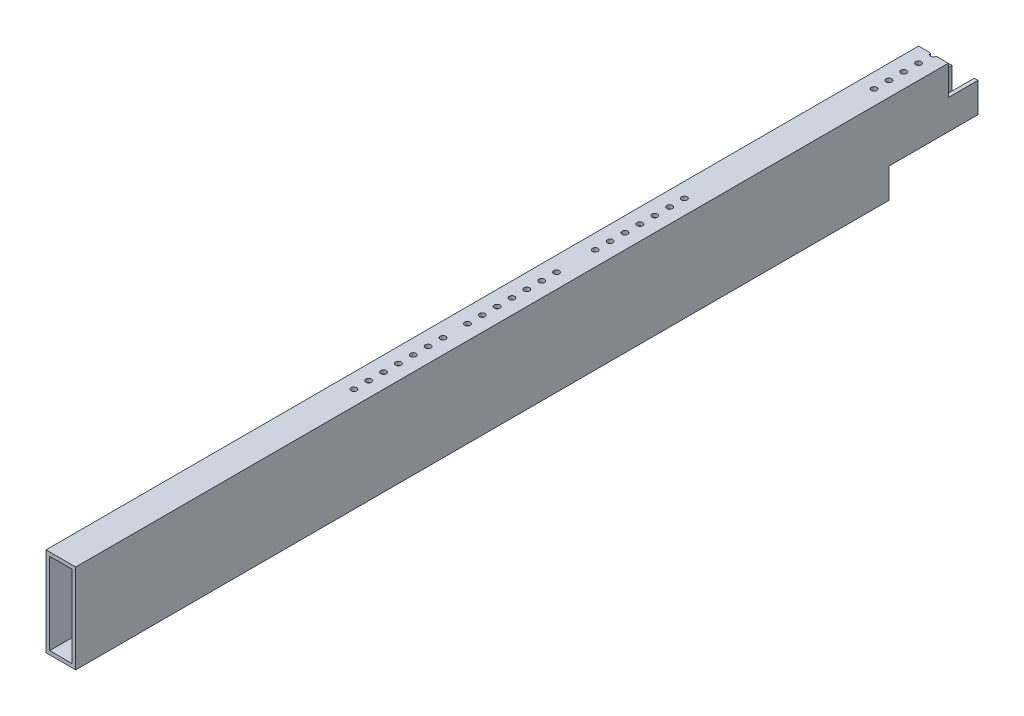
from build123d import *

# Parameters (mm, degrees)
SKETCH1_W           = 25.4
SKETCH1_H           = 76.2
BOSS_EXTRUDE1_DEPTH = 385.699
SHELL1_T            = -3.175
SKETCH2_W           = 76.2
SKETCH2_H           = 25.4
CUT_EXTRUDE1_DEPTH  = 389.407632007
SKETCH3_W           = 25.4
SKETCH3_H           = 25.4
CUT_EXTRUDE2_DEPTH  = 389.407632007
CUT_EXTRUDE3_REACH  = 395.359
SKETCH4_R           = 2.38125
CUT_EXTRUDE4_REACH  = 395.359
SKETCH5_R           = 2.38125


with BuildPart() as part:
    # Sketch1 → Boss-Extrude1 (new, symmetric)
    with BuildSketch(Plane.XY):
        Rectangle(SKETCH1_W, SKETCH1_H)
    extrude(amount=BOSS_EXTRUDE1_DEPTH, both=True)

    # Shell1
    shell1_openings = [part.faces().sort_by_distance(p)[0] for p in [
        (0, 0, -385.699),
        (0, 0, 385.699),
    ]]
    offset(amount=SHELL1_T, openings=shell1_openings, kind=Kind.INTERSECTION)

    # Sketch2 → Cut-Extrude1 (cut, through all)
    with BuildSketch(Plane(origin=(12.7, 0, 0), x_dir=(0, 0, -1), z_dir=(1, 0, 0))):
        with Locations((347.599, -25.4)):
            Rectangle(SKETCH2_W, SKETCH2_H)
    extrude(amount=-CUT_EXTRUDE1_DEPTH, mode=Mode.SUBTRACT)

    # Sketch3 → Cut-Extrude2 (cut, through all)
    with BuildSketch(Plane(origin=(12.7, 0, 0), x_dir=(0, 0, -1), z_dir=(1, 0, 0))):
        with Locations((372.999, 25.4)):
            Rectangle(SKETCH3_W, SKETCH3_H)
    extrude(amount=-CUT_EXTRUDE2_DEPTH, mode=Mode.SUBTRACT)

    # Sketch4 → Cut-Extrude3 (cut, up to next)
    with BuildSketch(Plane(origin=(0, 38.1, 0), x_dir=(1, 0, 0), z_dir=(0, 1, 0)), mode=Mode.PRIVATE) as cut_extrude3_sk1:
        with Locations((0, 147.394483214)):
            Circle(SKETCH4_R)
    cut_extrude3_tool1 = extrude(cut_extrude3_sk1.sketch, amount=-CUT_EXTRUDE3_REACH, mode=Mode.PRIVATE) & part.part
    # Sketch4 → Cut-Extrude3 (cut, up to next)
    with BuildSketch(Plane(origin=(0, 38.1, 0), x_dir=(1, 0, 0), z_dir=(0, 1, 0)), mode=Mode.PRIVATE) as cut_extrude3_sk2:
        with Locations((0, 134.694483214)):
            Circle(SKETCH4_R)
    cut_extrude3_tool2 = extrude(cut_extrude3_sk2.sketch, amount=-CUT_EXTRUDE3_REACH, mode=Mode.PRIVATE) & part.part
    # Sketch4 → Cut-Extrude3 (cut, up to next)
    with BuildSketch(Plane(origin=(0, 38.1, 0), x_dir=(1, 0, 0), z_dir=(0, 1, 0)), mode=Mode.PRIVATE) as cut_extrude3_sk3:
        with Locations((0, 121.994483214)):
            Circle(SKETCH4_R)
    cut_extrude3_tool3 = extrude(cut_extrude3_sk3.sketch, amount=-CUT_EXTRUDE3_REACH, mode=Mode.PRIVATE) & part.part
    # Sketch4 → Cut-Extrude3 (cut, up to next)
    with BuildSketch(Plane(origin=(0, 38.1, 0), x_dir=(1, 0, 0), z_dir=(0, 1, 0)), mode=Mode.PRIVATE) as cut_extrude3_sk4:
        with Locations((0, 109.294483214)):
            Circle(SKETCH4_R)
    cut_extrude3_tool4 = extrude(cut_extrude3_sk4.sketch, amount=-CUT_EXTRUDE3_REACH, mode=Mode.PRIVATE) & part.part
    # Sketch4 → Cut-Extrude3 (cut, up to next)
    with BuildSketch(Plane(origin=(0, 38.1, 0), x_dir=(1, 0, 0), z_dir=(0, 1, 0)), mode=Mode.PRIVATE) as cut_extrude3_sk5:
        with Locations((0, 96.594483214)):
            Circle(SKETCH4_R)
    cut_extrude3_tool5 = extrude(cut_extrude3_sk5.sketch, amount=-CUT_EXTRUDE3_REACH, mode=Mode.PRIVATE) & part.part
    # Sketch4 → Cut-Extrude3 (cut, up to next)
    with BuildSketch(Plane(origin=(0, 38.1, 0), x_dir=(1, 0, 0), z_dir=(0, 1, 0)), mode=Mode.PRIVATE) as cut_extrude3_sk6:
        with Locations((0, 83.894483214)):
            Circle(SKETCH4_R)
    cut_extrude3_tool6 = extrude(cut_extrude3_sk6.sketch, amount=-CUT_EXTRUDE3_REACH, mode=Mode.PRIVATE) & part.part
    # Sketch4 → Cut-Extrude3 (cut, up to next)
    with BuildSketch(Plane(origin=(0, 38.1, 0), x_dir=(1, 0, 0), z_dir=(0, 1, 0)), mode=Mode.PRIVATE) as cut_extrude3_sk7:
        with Locations((0, 71.194483214)):
            Circle(SKETCH4_R)
    cut_extrude3_tool7 = extrude(cut_extrude3_sk7.sketch, amount=-CUT_EXTRUDE3_REACH, mode=Mode.PRIVATE) & part.part
    # Sketch4 → Cut-Extrude3 (cut, up to next)
    with BuildSketch(Plane(origin=(0, 38.1, 0), x_dir=(1, 0, 0), z_dir=(0, 1, 0)), mode=Mode.PRIVATE) as cut_extrude3_sk8:
        with Locations((0, 38.09873)):
            Circle(SKETCH4_R)
    cut_extrude3_tool8 = extrude(cut_extrude3_sk8.sketch, amount=-CUT_EXTRUDE3_REACH, mode=Mode.PRIVATE) & part.part
    # Sketch4 → Cut-Extrude3 (cut, up to next)
    with BuildSketch(Plane(origin=(0, 38.1, 0), x_dir=(1, 0, 0), z_dir=(0, 1, 0)), mode=Mode.PRIVATE) as cut_extrude3_sk9:
        with Locations((0, 25.39873)):
            Circle(SKETCH4_R)
    cut_extrude3_tool9 = extrude(cut_extrude3_sk9.sketch, amount=-CUT_EXTRUDE3_REACH, mode=Mode.PRIVATE) & part.part
    # Sketch4 → Cut-Extrude3 (cut, up to next)
    with BuildSketch(Plane(origin=(0, 38.1, 0), x_dir=(1, 0, 0), z_dir=(0, 1, 0)), mode=Mode.PRIVATE) as cut_extrude3_sk10:
        with Locations((0, 12.69873)):
            Circle(SKETCH4_R)
    cut_extrude3_tool10 = extrude(cut_extrude3_sk10.sketch, amount=-CUT_EXTRUDE3_REACH, mode=Mode.PRIVATE) & part.part
    # Sketch4 → Cut-Extrude3 (cut, up to next)
    with BuildSketch(Plane(origin=(0, 38.1, 0), x_dir=(1, 0, 0), z_dir=(0, 1, 0)), mode=Mode.PRIVATE) as cut_extrude3_sk11:
        with Locations((0, -0.00127)):
            Circle(SKETCH4_R)
    cut_extrude3_tool11 = extrude(cut_extrude3_sk11.sketch, amount=-CUT_EXTRUDE3_REACH, mode=Mode.PRIVATE) & part.part
    # Sketch4 → Cut-Extrude3 (cut, up to next)
    with BuildSketch(Plane(origin=(0, 38.1, 0), x_dir=(1, 0, 0), z_dir=(0, 1, 0)), mode=Mode.PRIVATE) as cut_extrude3_sk12:
        with Locations((0, -12.70127)):
            Circle(SKETCH4_R)
    cut_extrude3_tool12 = extrude(cut_extrude3_sk12.sketch, amount=-CUT_EXTRUDE3_REACH, mode=Mode.PRIVATE) & part.part
    # Sketch4 → Cut-Extrude3 (cut, up to next)
    with BuildSketch(Plane(origin=(0, 38.1, 0), x_dir=(1, 0, 0), z_dir=(0, 1, 0)), mode=Mode.PRIVATE) as cut_extrude3_sk13:
        with Locations((0, -25.40127)):
            Circle(SKETCH4_R)
    cut_extrude3_tool13 = extrude(cut_extrude3_sk13.sketch, amount=-CUT_EXTRUDE3_REACH, mode=Mode.PRIVATE) & part.part
    # Sketch4 → Cut-Extrude3 (cut, up to next)
    with BuildSketch(Plane(origin=(0, 38.1, 0), x_dir=(1, 0, 0), z_dir=(0, 1, 0)), mode=Mode.PRIVATE) as cut_extrude3_sk14:
        with Locations((0, -38.10127)):
            Circle(SKETCH4_R)
    cut_extrude3_tool14 = extrude(cut_extrude3_sk14.sketch, amount=-CUT_EXTRUDE3_REACH, mode=Mode.PRIVATE) & part.part
    # Sketch4 → Cut-Extrude3 (cut, up to next)
    with BuildSketch(Plane(origin=(0, 38.1, 0), x_dir=(1, 0, 0), z_dir=(0, 1, 0)), mode=Mode.PRIVATE) as cut_extrude3_sk15:
        with Locations((0, -58.99324371)):
            Circle(SKETCH4_R)
    cut_extrude3_tool15 = extrude(cut_extrude3_sk15.sketch, amount=-CUT_EXTRUDE3_REACH, mode=Mode.PRIVATE) & part.part
    # Sketch4 → Cut-Extrude3 (cut, up to next)
    with BuildSketch(Plane(origin=(0, 38.1, 0), x_dir=(1, 0, 0), z_dir=(0, 1, 0)), mode=Mode.PRIVATE) as cut_extrude3_sk16:
        with Locations((0, -71.69324371)):
            Circle(SKETCH4_R)
    cut_extrude3_tool16 = extrude(cut_extrude3_sk16.sketch, amount=-CUT_EXTRUDE3_REACH, mode=Mode.PRIVATE) & part.part
    # Sketch4 → Cut-Extrude3 (cut, up to next)
    with BuildSketch(Plane(origin=(0, 38.1, 0), x_dir=(1, 0, 0), z_dir=(0, 1, 0)), mode=Mode.PRIVATE) as cut_extrude3_sk17:
        with Locations((0, -84.39324371)):
            Circle(SKETCH4_R)
    cut_extrude3_tool17 = extrude(cut_extrude3_sk17.sketch, amount=-CUT_EXTRUDE3_REACH, mode=Mode.PRIVATE) & part.part
    # Sketch4 → Cut-Extrude3 (cut, up to next)
    with BuildSketch(Plane(origin=(0, 38.1, 0), x_dir=(1, 0, 0), z_dir=(0, 1, 0)), mode=Mode.PRIVATE) as cut_extrude3_sk18:
        with Locations((0, -97.09324371)):
            Circle(SKETCH4_R)
    cut_extrude3_tool18 = extrude(cut_extrude3_sk18.sketch, amount=-CUT_EXTRUDE3_REACH, mode=Mode.PRIVATE) & part.part
    # Sketch4 → Cut-Extrude3 (cut, up to next)
    with BuildSketch(Plane(origin=(0, 38.1, 0), x_dir=(1, 0, 0), z_dir=(0, 1, 0)), mode=Mode.PRIVATE) as cut_extrude3_sk19:
        with Locations((0, -109.79324371)):
            Circle(SKETCH4_R)
    cut_extrude3_tool19 = extrude(cut_extrude3_sk19.sketch, amount=-CUT_EXTRUDE3_REACH, mode=Mode.PRIVATE) & part.part
    # Sketch4 → Cut-Extrude3 (cut, up to next)
    with BuildSketch(Plane(origin=(0, 38.1, 0), x_dir=(1, 0, 0), z_dir=(0, 1, 0)), mode=Mode.PRIVATE) as cut_extrude3_sk20:
        with Locations((0, -122.49324371)):
            Circle(SKETCH4_R)
    cut_extrude3_tool20 = extrude(cut_extrude3_sk20.sketch, amount=-CUT_EXTRUDE3_REACH, mode=Mode.PRIVATE) & part.part
    # Sketch4 → Cut-Extrude3 (cut, up to next)
    with BuildSketch(Plane(origin=(0, 38.1, 0), x_dir=(1, 0, 0), z_dir=(0, 1, 0)), mode=Mode.PRIVATE) as cut_extrude3_sk21:
        with Locations((0, -135.19324371)):
            Circle(SKETCH4_R)
    cut_extrude3_tool21 = extrude(cut_extrude3_sk21.sketch, amount=-CUT_EXTRUDE3_REACH, mode=Mode.PRIVATE) & part.part
    add(cut_extrude3_tool1.solids().sort_by_distance((0, 38.1, -147.394483))[0], mode=Mode.SUBTRACT)
    add(cut_extrude3_tool2.solids().sort_by_distance((0, 38.1, -134.694483))[0], mode=Mode.SUBTRACT)
    add(cut_extrude3_tool3.solids().sort_by_distance((0, 38.1, -121.994483))[0], mode=Mode.SUBTRACT)
    add(cut_extrude3_tool4.solids().sort_by_distance((0, 38.1, -109.294483))[0], mode=Mode.SUBTRACT)
    add(cut_extrude3_tool5.solids().sort_by_distance((0, 38.1, -96.594483))[0], mode=Mode.SUBTRACT)
    add(cut_extrude3_tool6.solids().sort_by_distance((0, 38.1, -83.894483))[0], mode=Mode.SUBTRACT)
    add(cut_extrude3_tool7.solids().sort_by_distance((0, 38.1, -71.194483))[0], mode=Mode.SUBTRACT)
    add(cut_extrude3_tool8.solids().sort_by_distance((0, 38.1, -38.09873))[0], mode=Mode.SUBTRACT)
    add(cut_extrude3_tool9.solids().sort_by_distance((0, 38.1, -25.39873))[0], mode=Mode.SUBTRACT)
    add(cut_extrude3_tool10.solids().sort_by_distance((0, 38.1, -12.69873))[0], mode=Mode.SUBTRACT)
    add(cut_extrude3_tool11.solids().sort_by_distance((0, 38.1, 0.00127))[0], mode=Mode.SUBTRACT)
    add(cut_extrude3_tool12.solids().sort_by_distance((0, 38.1, 12.70127))[0], mode=Mode.SUBTRACT)
    add(cut_extrude3_tool13.solids().sort_by_distance((0, 38.1, 25.40127))[0], mode=Mode.SUBTRACT)
    add(cut_extrude3_tool14.solids().sort_by_distance((0, 38.1, 38.10127))[0], mode=Mode.SUBTRACT)
    add(cut_extrude3_tool15.solids().sort_by_distance((0, 38.1, 58.993244))[0], mode=Mode.SUBTRACT)
    add(cut_extrude3_tool16.solids().sort_by_distance((0, 38.1, 71.693244))[0], mode=Mode.SUBTRACT)
    add(cut_extrude3_tool17.solids().sort_by_distance((0, 38.1, 84.393244))[0], mode=Mode.SUBTRACT)
    add(cut_extrude3_tool18.solids().sort_by_distance((0, 38.1, 97.093244))[0], mode=Mode.SUBTRACT)
    add(cut_extrude3_tool19.solids().sort_by_distance((0, 38.1, 109.793244))[0], mode=Mode.SUBTRACT)
    add(cut_extrude3_tool20.solids().sort_by_distance((0, 38.1, 122.493244))[0], mode=Mode.SUBTRACT)
    add(cut_extrude3_tool21.solids().sort_by_distance((0, 38.1, 135.193244))[0], mode=Mode.SUBTRACT)

    # Sketch5 → Cut-Extrude4 (cut, up to next)
    with BuildSketch(Plane(origin=(0, 38.1, 0), x_dir=(1, 0, 0), z_dir=(0, 1, 0)), mode=Mode.PRIVATE) as cut_extrude4_sk1:
        with Locations((0, 360.299)):
            Circle(SKETCH5_R)
    cut_extrude4_tool1 = extrude(cut_extrude4_sk1.sketch, amount=-CUT_EXTRUDE4_REACH, mode=Mode.PRIVATE) & part.part
    # Sketch5 → Cut-Extrude4 (cut, up to next)
    with BuildSketch(Plane(origin=(0, 38.1, 0), x_dir=(1, 0, 0), z_dir=(0, 1, 0)), mode=Mode.PRIVATE) as cut_extrude4_sk2:
        with Locations((0, 347.599)):
            Circle(SKETCH5_R)
    cut_extrude4_tool2 = extrude(cut_extrude4_sk2.sketch, amount=-CUT_EXTRUDE4_REACH, mode=Mode.PRIVATE) & part.part
    # Sketch5 → Cut-Extrude4 (cut, up to next)
    with BuildSketch(Plane(origin=(0, 38.1, 0), x_dir=(1, 0, 0), z_dir=(0, 1, 0)), mode=Mode.PRIVATE) as cut_extrude4_sk3:
        with Locations((0, 334.899)):
            Circle(SKETCH5_R)
    cut_extrude4_tool3 = extrude(cut_extrude4_sk3.sketch, amount=-CUT_EXTRUDE4_REACH, mode=Mode.PRIVATE) & part.part
    # Sketch5 → Cut-Extrude4 (cut, up to next)
    with BuildSketch(Plane(origin=(0, 38.1, 0), x_dir=(1, 0, 0), z_dir=(0, 1, 0)), mode=Mode.PRIVATE) as cut_extrude4_sk4:
        with Locations((0, 322.199)):
            Circle(SKETCH5_R)
    cut_extrude4_tool4 = extrude(cut_extrude4_sk4.sketch, amount=-CUT_EXTRUDE4_REACH, mode=Mode.PRIVATE) & part.part
    # Sketch5 → Cut-Extrude4 (cut, up to next)
    with BuildSketch(Plane(origin=(0, 38.1, 0), x_dir=(1, 0, 0), z_dir=(0, 1, 0)), mode=Mode.PRIVATE) as cut_extrude4_sk5:
        with Locations((0, 309.499)):
            Circle(SKETCH5_R)
    cut_extrude4_tool5 = extrude(cut_extrude4_sk5.sketch, amount=-CUT_EXTRUDE4_REACH, mode=Mode.PRIVATE) & part.part
    add(cut_extrude4_tool1.solids().sort_by_distance((0, 38.1, -360.299))[0], mode=Mode.SUBTRACT)
    add(cut_extrude4_tool2.solids().sort_by_distance((0, 38.1, -347.599))[0], mode=Mode.SUBTRACT)
    add(cut_extrude4_tool3.solids().sort_by_distance((0, 38.1, -334.899))[0], mode=Mode.SUBTRACT)
    add(cut_extrude4_tool4.solids().sort_by_distance((0, 38.1, -322.199))[0], mode=Mode.SUBTRACT)
    add(cut_extrude4_tool5.solids().sort_by_distance((0, 38.1, -309.499))[0], mode=Mode.SUBTRACT)


solid = part.part
